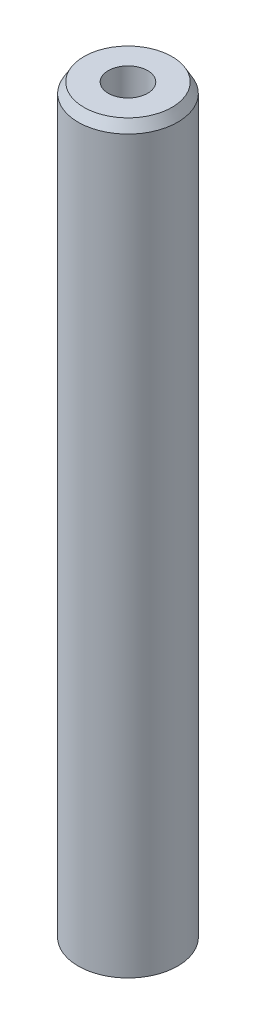
from build123d import *
from OCP.BRepFilletAPI import BRepFilletAPI_MakeChamfer

# Parameters (mm, degrees)
SKETCH1_R           = 15
BOSS_EXTRUDE1_DEPTH = 224.992049205
SKETCH2_R           = 5.933303061
CUT_EXTRUDE1_DEPTH  = 226.989871909
CHAMFER1_SIZE       = 3.011013272
CHAMFER1_SIZE2      = 1.733730848


with BuildPart() as part:
    # Sketch1 → Boss-Extrude1 (new body)
    with BuildSketch(Plane(origin=(0, 0, 0), x_dir=(1, 0, 0), z_dir=(0, 1, 0))):
        Circle(SKETCH1_R)
    extrude(amount=BOSS_EXTRUDE1_DEPTH)

    # Sketch2 → Cut-Extrude1 (cut, through all)
    with BuildSketch(Plane(origin=(0, 0, 0), x_dir=(1, 0, 0), z_dir=(0, 1, 0))):
        Circle(SKETCH2_R)
    extrude(amount=CUT_EXTRUDE1_DEPTH, mode=Mode.SUBTRACT)

    # Chamfer1: one chamfer whose edges measure the first distance from different faces: ONE call of the kernel's chamfer builder (chamfer() names one face for all edges)
    chamfer1_edges_1 = [part.edges().sort_by_distance(p)[0] for p in [
        (-15, 224.992049205, 0),
    ]]
    chamfer1_side_1 = [part.faces().sort_by_distance(p)[0] for p in [
        (-15, 112.496024602, 0),
    ]]
    chamfer1_edges_2 = [part.edges().sort_by_distance(p)[0] for p in [
        (-15, 0, 0),
    ]]
    chamfer1_side_2 = [part.faces().sort_by_distance(p)[0] for p in [
        (-14.575735931, 0, 0),
    ]]
    chamfer1 = BRepFilletAPI_MakeChamfer(part.part.solid().wrapped)
    for e in chamfer1_edges_1:
        chamfer1.Add(CHAMFER1_SIZE, CHAMFER1_SIZE2, e.wrapped, chamfer1_side_1[0].wrapped)  # the first distance lies on this face
    for e in chamfer1_edges_2:
        chamfer1.Add(CHAMFER1_SIZE, CHAMFER1_SIZE2, e.wrapped, chamfer1_side_2[0].wrapped)  # the first distance lies on this face
    add(Compound.cast(chamfer1.Shape()), mode=Mode.REPLACE)


solid = part.part
